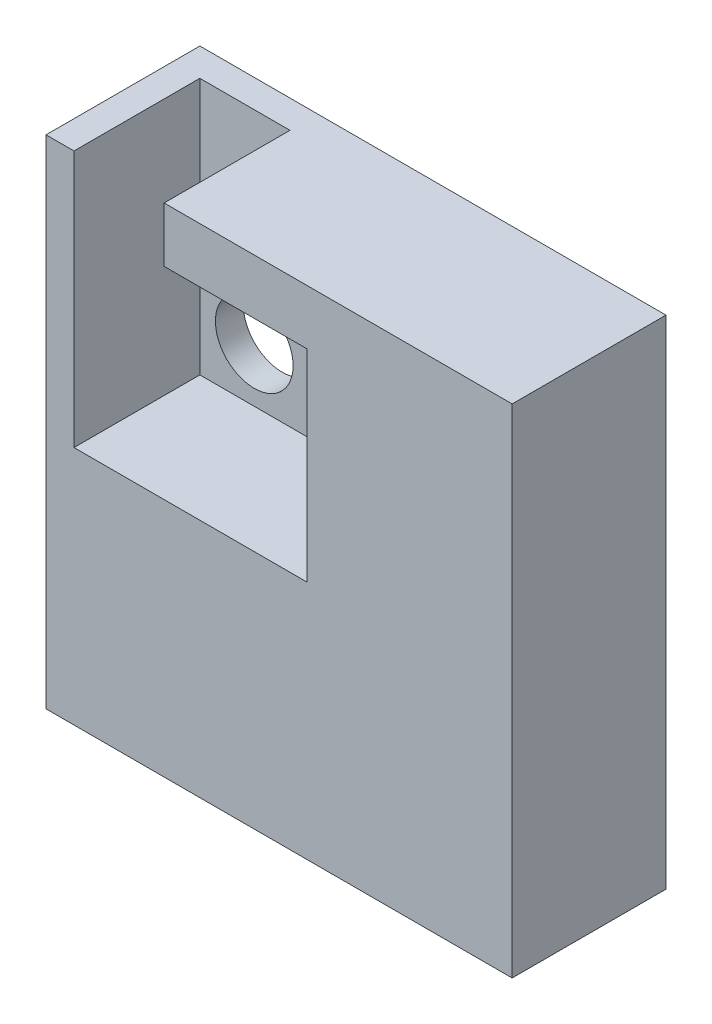
from build123d import *

# Parameters (mm, degrees)
SKETCH1_W           = 30
SKETCH1_H           = 32
BOSS_EXTRUDE1_DEPTH = 9.9
CUT_EXTRUDE1_DEPTH  = 8.1
SKETCH3_R           = 2.5
CUT_EXTRUDE2_DEPTH  = 45.605044558


with BuildPart() as part:
    # Sketch1 → Boss-Extrude1 (new body)
    with BuildSketch(Plane.XY):
        with Locations((15, 16)):
            Rectangle(SKETCH1_W, SKETCH1_H)
    extrude(amount=BOSS_EXTRUDE1_DEPTH)

    # Sketch2 → Cut-Extrude1 (cut)
    with BuildSketch(Plane.XY.offset(9.9)):
        Polygon((7.6, 32), (7.6, 28.466915374), (16.8, 28.466915374), (16.8, 15.466915374), (1.8, 15.466915374), (1.8, 28.466915374), (1.8, 32), align=None)
    extrude(amount=-CUT_EXTRUDE1_DEPTH, mode=Mode.SUBTRACT)

    # Sketch3 → Cut-Extrude2 (cut, through all)
    with BuildSketch(Plane.XY.offset(1.8)):
        with Locations((5.3, 18.966915374)):
            Circle(SKETCH3_R)
    extrude(amount=-CUT_EXTRUDE2_DEPTH, mode=Mode.SUBTRACT)


solid = part.part
